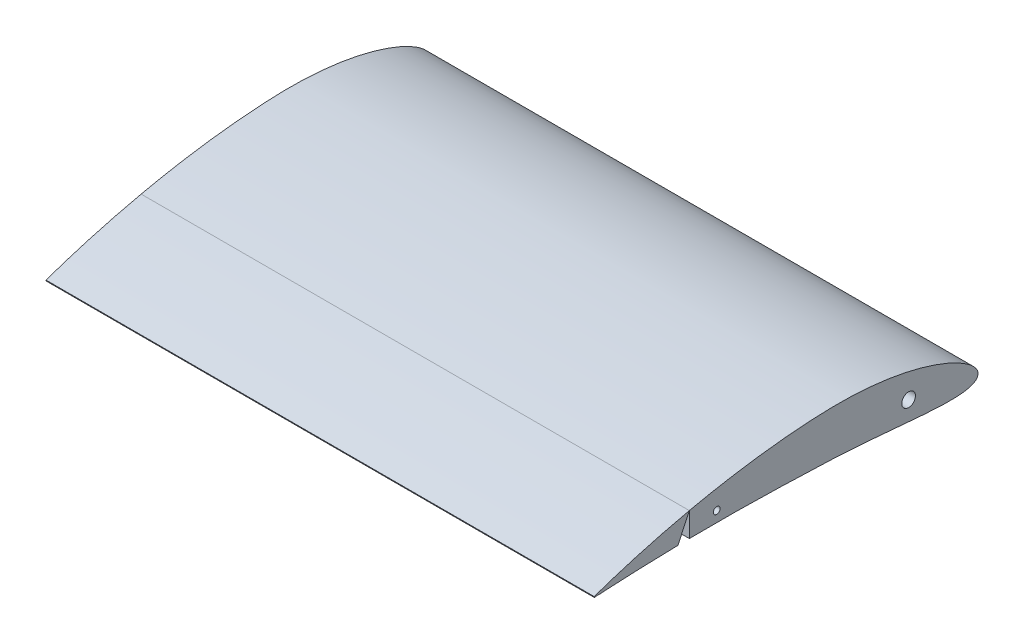
from build123d import *

# Parameters (mm, degrees)
BOSS_EXTRUDE1_DEPTH      = 254
BOSS_EXTRUDE1_DEPTH_BACK = 254
CUT_EXTRUDE1_REACH       = 623.109
SKETCH4_R                = 6.35
CUT_EXTRUDE2_DEPTH       = 101.6
SKETCH5_R                = 3.175
CUT_EXTRUDE3_DEPTH       = 127


with BuildPart() as part:
    # Sketch1 → Boss-Extrude1 (new, two sides: drawn at the far end of the back side and taken through both)
    with BuildSketch(Plane(origin=(0, 0, 0), x_dir=(0, 0, -1), z_dir=(1, 0, 0)).offset(-BOSS_EXTRUDE1_DEPTH_BACK)):
        with BuildLine():
            Line((-354.787327228, -0.030257196), (-354.876173011, 0.410417887))
            add(Edge.make_bspline(
                [(-354.876173011, 0.410417887), (-354.559877309, 0.519388), (-353.29965963, 0.95355787), (-350.47872665, 1.927095868), (-345.800950265, 3.497798274), (-336.024074692, 6.721551148), (-319.654473712, 11.798891927), (-300.598349456, 17.130600639), (-282.422876264, 21.724272526), (-261.175777938, 26.651569731), (-238.622276389, 31.145528798), (-208.774809213, 36.004755717), (-183.96165787, 39.090454058), (-158.902335219, 41.113212891), (-140.096691022, 42.111376668), (-121.516747473, 42.228858195), (-103.422167262, 41.321050632), (-86.188408528, 39.478676181), (-70.043450957, 36.810480574), (-55.199760436, 33.432905997), (-41.843390777, 29.510854383), (-30.130463623, 25.220125297), (-20.187014188, 20.73431935), (-12.107203154, 16.226289935), (-5.926897661, 11.855341958), (-1.679224073, 7.716499794), (0.765838065, 3.796757813), (0.987487677, -0.148325216), (-1.35108726, -3.308943186), (-5.450780885, -5.288085739), (-11.087315968, -6.587464624), (-18.34911979, -7.268527656), (-27.163826626, -7.404874951), (-37.447057223, -7.053797092), (-49.083078017, -6.301866785), (-61.95239395, -5.238034817), (-75.929862643, -3.983911698), (-96.406736552, -2.153555858), (-117.937239158, -0.458414508), (-140.484776897, 0.674535203), (-158.296467959, 1.286744043), (-176.48388462, 1.917893193), (-200.671973719, 2.586246563), (-224.541124114, 2.979106232), (-247.830237405, 3.028480659), (-264.337268621, 2.907447598), (-279.933149694, 2.656365926), (-294.437996632, 2.282890374), (-307.681856469, 1.852126627), (-319.513378006, 1.371074809), (-329.767358246, 0.912902227), (-338.388880463, 0.426846955), (-345.076973543, 0.191518705), (-350.227621538, -0.406394891), (-352.780150329, -0.035387827), (-354.744619464, -0.75811662), (-354.777220059, -0.20251155), (-354.787327228, -0.030257196)],
                knots=[0, 0, 0, 0, 0.001371577, 0.005464776, 0.012234802, 0.021601969, 0.04767125, 0.082496261, 0.102719149, 0.124527079, 0.171912573, 0.19697838, 0.248496767, 0.274385101, 0.300041178, 0.325689988, 0.350525088, 0.374279703, 0.396711254, 0.417576734, 0.436654006, 0.45374439, 0.468679994, 0.481329415, 0.491630702, 0.499615789, 0.505546281, 0.510184984, 0.514824194, 0.520701508, 0.52851604, 0.538465752, 0.550542609, 0.564643256, 0.580638139, 0.598344876, 0.617584458, 0.638174401, 0.682632113, 0.706120665, 0.730727383, 0.755700244, 0.780731769, 0.829932396, 0.853570292, 0.876213105, 0.897609987, 0.917519394, 0.935698347, 0.951942678, 0.966047159, 0.97783994, 0.987174002, 0.993931501, 0.998018399, 0.999385644, 1, 1, 1, 1], degree=3))
        make_face()
    extrude(amount=BOSS_EXTRUDE1_DEPTH + BOSS_EXTRUDE1_DEPTH_BACK)

    # Sketch2 → Cut-Extrude1 (cut, up to next)
    with BuildSketch(Plane.ZY.offset(254), mode=Mode.PRIVATE) as cut_extrude1_sk1:
        Polygon((266.7, 25.310988042), (266.7, 2.06571301), (277.539449763, 2.06571301), align=None)
    cut_extrude1_tool1 = extrude(cut_extrude1_sk1.sketch, amount=-CUT_EXTRUDE1_REACH, mode=Mode.PRIVATE) & part.part
    add(cut_extrude1_tool1.solids().sort_by_distance((-254, 9.814138, 270.31315))[0], mode=Mode.SUBTRACT)


with BuildPart() as cut_extrude1_piece_1:
    # of the separate pieces the step leaves, piece 1, a body of its own (cut_extrude1_pieces)
    add(part.part.solids().sort_by_distance((0, 2.854788865, 266.7))[0])

    # Sketch4 → Cut-Extrude2 (cut)
    with BuildSketch(Plane.ZY.offset(254)):
        with Locations((63.5, 12.7)):
            Circle(SKETCH4_R)
    cut_extrude2 = extrude(amount=-CUT_EXTRUDE2_DEPTH, mode=Mode.SUBTRACT)

    # Mirror1: Cut-Extrude2 across plane
    add(cut_extrude2.mirror(Plane(origin=(0, 0, 0), x_dir=(0, 0, 1), z_dir=(1, 0, 0))), mode=Mode.SUBTRACT)

    # Sketch5 → Cut-Extrude3 (cut)
    with BuildSketch(Plane.ZY.offset(254)):
        with Locations((241.3, 12.7)):
            Circle(SKETCH5_R)
    cut_extrude3 = extrude(amount=-CUT_EXTRUDE3_DEPTH, mode=Mode.SUBTRACT)

    # Mirror2: Cut-Extrude3 across plane
    add(cut_extrude3.mirror(Plane(origin=(0, 0, 0), x_dir=(0, 0, 1), z_dir=(1, 0, 0))), mode=Mode.SUBTRACT)


with BuildPart() as cut_extrude1_piece_2:
    # of the separate pieces the step leaves, piece 2, a body of its own (cut_extrude1_pieces)
    add(part.part.solids().sort_by_distance((0, -0.030257196, 354.787327228))[0])


solid = Compound([cut_extrude1_piece_1.part, cut_extrude1_piece_2.part])
